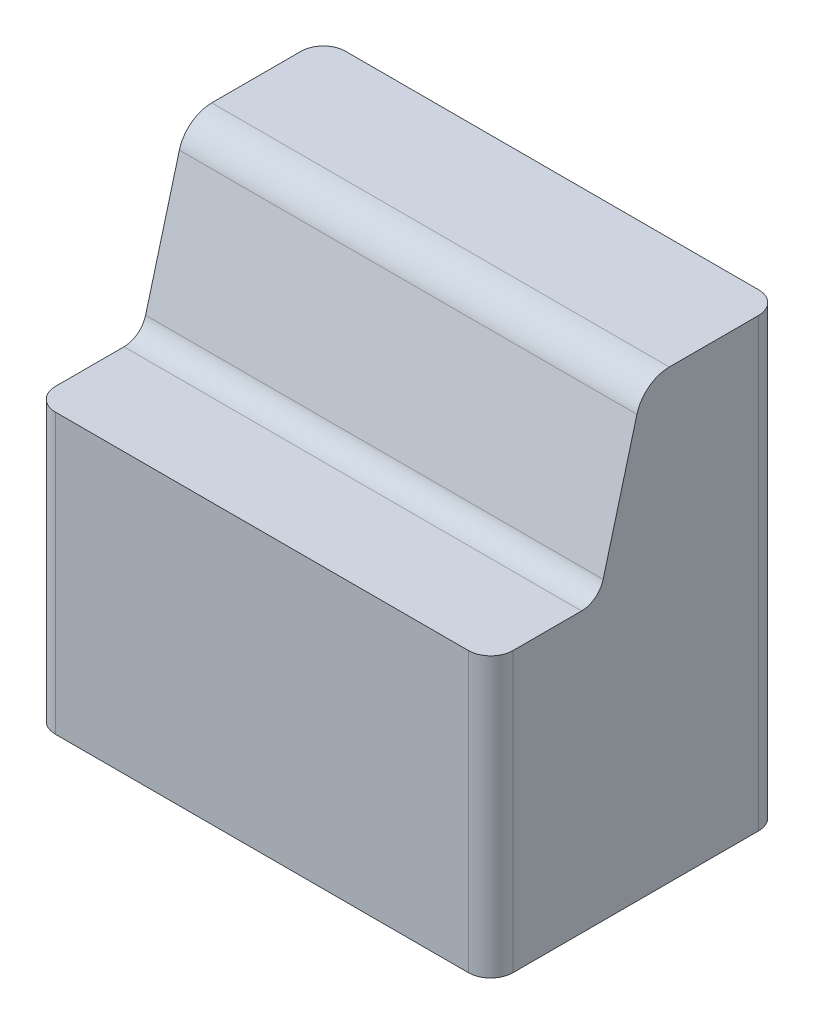
from build123d import *

# Parameters (mm, degrees)
BOSS_EXTRUDE1_DEPTH         = 20.5
FILLET1_R                   = 2
M6_TAPPED_HOLE1_D           = 5
M6_TAPPED_HOLE1_DEPTH       = 17
M6_TAPPED_HOLE1_CSINK_D     = 6.05
M6_TAPPED_HOLE1_CSINK_ANGLE = 90
M6_TAPPED_HOLE1_TIP         = 1.502151548
FILLET2_R                   = 2


with BuildPart() as part:
    # Sketch1 → Boss-Extrude1 (new, symmetric)
    with BuildSketch(Plane(origin=(0, 0, 0), x_dir=(0, 0, -1), z_dir=(1, 0, 0))):
        with BuildLine():
            Line((-10, 0), (0, 0))
            Line((0, 0), (0, -40))
            Line((0, -40), (-26, -40))
            Line((-26, -40), (-26, -15))
            Line((-26, -15), (-16.32121885, -15))
            Line((-16.32121885, -15), (-12.897777479, -2.223542865))
            ThreePointArc((-12.897777479, -2.223542865), (-11.826284287, -0.619939979), (-10, 0))
        make_face()
    extrude(amount=BOSS_EXTRUDE1_DEPTH, both=True)

    # Fillet1
    fillet1_edges = [part.edges().sort_by_distance(p)[0] for p in [
        (-20.5, -20, 0),
        (-20.5, -27.5, 26),
        (20.5, -20, 0),
        (20.5, -27.5, 26),
    ]]
    fillet(fillet1_edges, radius=FILLET1_R)

    # M6 Tapped Hole1
    with Locations(Plane(origin=(0, -40, 0), x_dir=(-1, 0, 0), z_dir=(0, -1, 0))):
        with Locations((-13, -7.5), (13, -7.5)):
            CounterSinkHole(M6_TAPPED_HOLE1_D / 2, M6_TAPPED_HOLE1_CSINK_D / 2, depth=M6_TAPPED_HOLE1_DEPTH, counter_sink_angle=M6_TAPPED_HOLE1_CSINK_ANGLE)
            with Locations((0, 0, -(M6_TAPPED_HOLE1_DEPTH + M6_TAPPED_HOLE1_TIP / 2))):  # 118° drill point
                Cone(0, M6_TAPPED_HOLE1_D / 2, M6_TAPPED_HOLE1_TIP, mode=Mode.SUBTRACT)

    # Fillet2
    fillet2_edges = [part.edges().sort_by_distance(p)[0] for p in [
        (0, -15, 16.32121885),
    ]]
    fillet(fillet2_edges, radius=FILLET2_R)


solid = part.part
